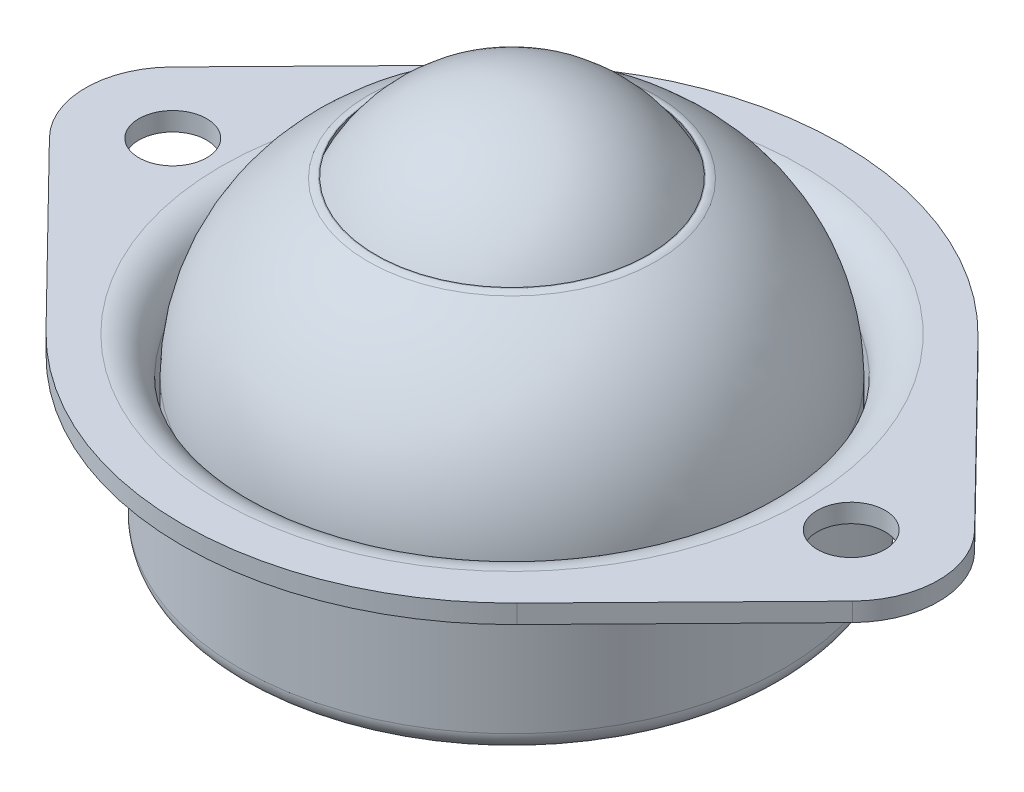
from build123d import *

# Parameters (mm, degrees)
SKETCH1_R           = 2.778125
BOSS_EXTRUDE1_DEPTH = 1.524
SKETCH3_R           = 23.8125
CUT_EXTRUDE1_DEPTH  = 47.372437474
FILLET1_R           = 1.27


# Read off the part's stored shape, not the designer's step: Move Face1
with BuildPart() as part:
    # Sketch1 → Boss-Extrude1 (new body)
    with BuildSketch(Plane(origin=(0, 0, 0), x_dir=(1, 0, 0), z_dir=(0, 1, 0))):
        with BuildLine():
            Line((-32.883928571, 4.999583529), (-19.276785714, 18.887315552))
            ThreePointArc((-19.276785714, 18.887315552), (0, 26.9875), (19.276785714, 18.887315552))
            Line((19.276785714, 18.887315552), (32.883928571, 4.999583529))
            ThreePointArc((32.883928571, 4.999583529), (34.925, 0), (32.883928571, -4.999583529))
            Line((32.883928571, -4.999583529), (19.276785714, -18.887315552))
            ThreePointArc((19.276785714, -18.887315552), (0, -26.9875), (-19.276785714, -18.887315552))
            Line((-19.276785714, -18.887315552), (-32.883928571, -4.999583529))
            ThreePointArc((-32.883928571, -4.999583529), (-34.925, 0), (-32.883928571, 4.999583529))
        make_face()
        with Locations(Location((-27.78125, 0, 0), (0, 0, 90))):
            Circle(SKETCH1_R, mode=Mode.SUBTRACT)
        with Locations(Location((27.78125, 0, 0), (0, 0, 90))):
            Circle(SKETCH1_R, mode=Mode.SUBTRACT)
    extrude(amount=BOSS_EXTRUDE1_DEPTH)

    # Sketch3 → Cut-Extrude1 (cut, through all)
    with BuildSketch(Plane(origin=(0, 1.524, 0), x_dir=(1, 0, 0), z_dir=(0, 1, 0))):
        with Locations(Location((0, 0, 0), (0, 0, 270))):
            Circle(SKETCH3_R)
    extrude(amount=-CUT_EXTRUDE1_DEPTH, mode=Mode.SUBTRACT)


with BuildPart() as body_2:
    # Sketch2 → Revolve1 (revolve)
    with BuildSketch(Plane.XY, mode=Mode.PRIVATE) as revolve1_sk:
        with BuildLine():
            Line((0, 12.7), (11.506522628, 12.7))
            ThreePointArc((11.506522628, 12.7), (17.983543358, 6.822811878), (20.3835, -1.5875))
            Line((20.3835, -1.5875), (20.3835, -11.1125))
            ThreePointArc((20.3835, -11.1125), (20.54225, -11.27125), (20.701, -11.1125))
            Line((20.701, -11.1125), (20.701, -1.5875))
            ThreePointArc((20.701, -1.5875), (21.61233725, 0.61266275), (23.8125, 1.524))
            Line((23.8125, 1.524), (23.8125, 0))
            ThreePointArc((23.8125, 0), (22.689967985, -0.464967985), (22.225, -1.5875))
            Line((22.225, -1.5875), (22.225, -11.1125))
            ThreePointArc((22.225, -11.1125), (21.760032015, -12.235032015), (20.6375, -12.7))
            Line((20.6375, -12.7), (0, -12.7))
            Line((0, -12.7), (0, 12.7))
        make_face()
    revolve(revolve1_sk.sketch.rotate(Axis((0, 12.7, 0), (0, -1, 0)), 180), axis=Axis((0, 12.7, 0), (0, -1, 0)))

    # Combine1: union part
    add(part.part)

    # Sketch4<2> → Cut-Revolve1 (revolve, cut)
    with BuildSketch(Plane.XY):
        with BuildLine():
            Line((0, 19.05), (0, -6.35))
            ThreePointArc((0, -6.35), (12.7, 6.35), (0, 19.05))
        make_face()
    revolve(axis=Axis((0, 19.05, 0), (0, -1, 0)), mode=Mode.SUBTRACT)

    # Move Face1 outline → Move Face1 (revolve, cut)
    with BuildSketch(Plane.XY):
        with BuildLine():
            Line((0, -6.35), (0, -6.477))
            ThreePointArc((0, -6.477), (11.090161837, -0.095171792), (11.144928392, 12.700000011))
            Line((11.144928392, 12.700000011), (10.998522622, 12.700000011))
            ThreePointArc((10.998522622, 12.700000011), (10.998522631, 5e-09), (0, -6.35))
        make_face()
    revolve(axis=Axis((0, 0, 0), (0, 1, 0)), mode=Mode.SUBTRACT)

    # Fillet1
    fillet1_edges = [body_2.edges().sort_by_distance(p)[0] for p in [
        (11.506522628, 12.7, 0),
    ]]
    fillet(fillet1_edges, radius=FILLET1_R)


with BuildPart() as body_2_2:
    # Sketch4 → Revolve2 (revolve)
    with BuildSketch(Plane.XY):
        with BuildLine():
            Line((0, 19.05), (0, -6.35))
            ThreePointArc((0, -6.35), (12.7, 6.35), (0, 19.05))
        make_face()
    revolve(axis=Axis((0, 19.05, 0), (0, -1, 0)))


solid = Compound([body_2.part, body_2_2.part])
